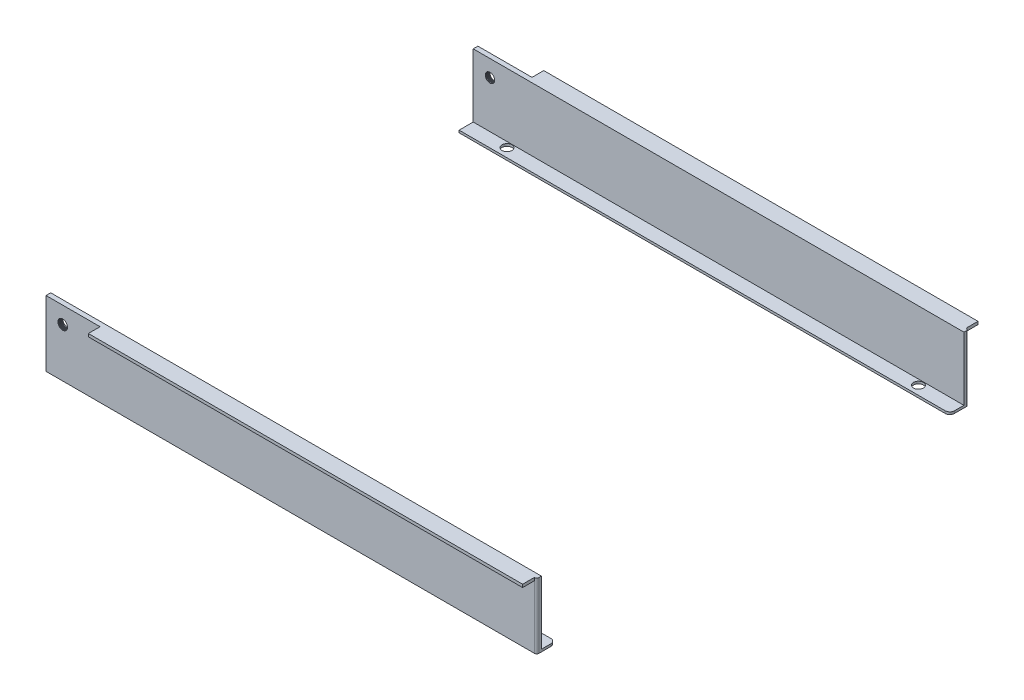
from build123d import *

# Parameters (mm, degrees)
SKETCH_1_W          = 230
SKETCH_1_H          = 30
EXTRUDE_1_DEPTH     = 2
SKETCH_2_W          = 183
SKETCH_2_H          = 1
EXTRUDE_2_DEPTH     = 5
FILLET_1_R          = 2
FILLET_2_R          = 2
SKETCH_3_W          = 230
SKETCH_3_H          = 0.999899536
EXTRUDE_3_DEPTH     = 6
FILLET_3_R          = 2
FILLET_4_R          = 2
SKETCH_4_R          = 2
CUT_EXTRUDE_1_DEPTH = 6
THREAD_1_PITCH      = 0.5
FILLET_5_R          = 2
FILLET_6_R          = 1
FILLET_7_R          = 1
SKETCH_6_W          = 24.259923812
SKETCH_6_H          = 36.468143538
CUT_EXTRUDE_5_DEPTH = 15
SKETCH_7_R          = 2.1
CUT_EXTRUDE_6_DEPTH = 10
SKETCH_8_W          = 7
SKETCH_8_H          = 2
CUT_EXTRUDE_8_DEPTH = 218
SKETCH_9_W          = 185
SKETCH_9_H          = 1.24
EXTRUDE_4_DEPTH     = 5


with BuildPart() as part:
    # Sketch 1 → 填料-伸長1 (new body)
    with BuildSketch(Plane.XY):
        Rectangle(SKETCH_1_W, SKETCH_1_H)
    extrude(amount=EXTRUDE_1_DEPTH)

    # 草圖2 → 填料-伸長2 (add)
    with BuildSketch(Plane.XY.offset(2)):
        with Locations((23.5, 14.5)):
            Rectangle(SKETCH_2_W, SKETCH_2_H)
    extrude(amount=EXTRUDE_2_DEPTH)

    # 圓角1
    fillet_1_edges = [part.edges().sort_by_distance(p)[0] for p in [
        (-68, 14.5, 7),
    ]]
    fillet(fillet_1_edges, radius=FILLET_1_R)

    # 圓角2
    fillet_2_edges = [part.edges().sort_by_distance(p)[0] for p in [
        (115, 14.5, 7),
    ]]
    fillet(fillet_2_edges, radius=FILLET_2_R)

    # 草圖3 → 填料-伸長3 (add)
    with BuildSketch(Plane(origin=(0, 0, 0), x_dir=(-1, 0, 0), z_dir=(0, 0, -1))):
        with Locations((0, -14.500050232)):
            Rectangle(SKETCH_3_W, SKETCH_3_H)
    extrude(amount=EXTRUDE_3_DEPTH)

    # 圓角3
    fillet_3_edges = [part.edges().sort_by_distance(p)[0] for p in [
        (-115, -14.500050232, -6),
    ]]
    fillet(fillet_3_edges, radius=FILLET_3_R)

    # 圓角4
    fillet_4_edges = [part.edges().sort_by_distance(p)[0] for p in [
        (115, -14.500050232, -6),
    ]]
    fillet(fillet_4_edges, radius=FILLET_4_R)

    # 草圖4 → 除料-伸長1 (cut)
    with BuildSketch(Plane.XY.offset(2)):
        with Locations((-86.90574959, 5.915633798)):
            Circle(SKETCH_4_R)
    extrude(amount=-CUT_EXTRUDE_1_DEPTH, mode=Mode.SUBTRACT)

    # 螺紋1: the profile of Sketch 1 2 profile screwed along a right-hand helix of 20 turns, 6 arcs to a turn; built about Z, then put on its axis
    thread_1_z = Axis((0, 0, 0), (0, 0, 1))
    thread_1_corners = [(1.9997, 0, -0.000173205), (2.2, 0, 0.115470054), (2.2, 0, 0.155157554), (1.9997, 0, 0.270800813)]
    with BuildLine(mode=Mode.PRIVATE) as thread_1_profile:
        Line(thread_1_corners[0], thread_1_corners[1])
        Line(thread_1_corners[1], thread_1_corners[2])
        Line(thread_1_corners[2], thread_1_corners[3])
        Line(thread_1_corners[3], thread_1_corners[0])
    thread_1_cap = Face(thread_1_profile.wire())
    thread_1_turn_angles = [0, 30, 60, 90, 120, 150, 180, 210, 240, 270, 300, 330, 360]
    thread_1_turn_weights = [1, 0.8660254037844387, 1, 0.8660254037844387, 1, 0.8660254037844387, 1, 0.8660254037844387, 1, 0.8660254037844387, 1, 0.8660254037844387, 1]
    thread_1_turn_rails = [Edge.make_bspline([Vector(p[0], p[1], 0).rotate(thread_1_z, thread_1_turn_angles[k]) / thread_1_turn_weights[k] + Vector(0, 0, p[2] + THREAD_1_PITCH * thread_1_turn_angles[k] / 360) for k in range(13)], [0, 0, 0, 1, 1, 2, 2, 3, 3, 4, 4, 5, 5, 6, 6, 6], 2, thread_1_turn_weights) for p in thread_1_corners]
    thread_1_turn_sides = [Face.make_surface_from_curves(thread_1_turn_rails[p[0]], thread_1_turn_rails[p[1]]) for p in [(0, 1), (1, 2), (2, 3), (3, 0)]]
    thread_1 = Plane(origin=(-86.90574959, 5.915633798, 0), x_dir=(1, 0, 0), z_dir=(0, 0, 1)) * Solid(Shell([*[p.moved(Location((0, 0, THREAD_1_PITCH * i))) for i in range(20) for p in thread_1_turn_sides], thread_1_cap, thread_1_cap.rotate(thread_1_z, 7200).moved(Location((0, 0, THREAD_1_PITCH * 7200 / 360)))]))
    add(thread_1, mode=Mode.SUBTRACT)

    # 圓角5
    fillet_5_edges = [part.edges().sort_by_distance(p)[0] for p in [
        (-115, 15, 1),
    ]]
    fillet(fillet_5_edges, radius=FILLET_5_R)

    # 圓角6
    fillet_6_edges = [part.edges().sort_by_distance(p)[0] for p in [
        (1, 15, 0),
        (-115, -0.500050232, 0),
        (-114.414213562, 14.414213562, 0),
    ]]
    fillet(fillet_6_edges, radius=FILLET_6_R)

    # 圓角7
    fillet_7_edges = [part.edges().sort_by_distance(p)[0] for p in [
        (115, -0.5, 2),
    ]]
    fillet(fillet_7_edges, radius=FILLET_7_R)

    # 草圖6 → 除料-伸長5 (cut)
    with BuildSketch(Plane.XY.offset(7)):
        with Locations((-106.171437047, -1.461218557)):
            Rectangle(SKETCH_6_W, SKETCH_6_H)
    extrude(amount=-CUT_EXTRUDE_5_DEPTH, mode=Mode.SUBTRACT)

    # 草圖7 → 除料-伸長6 (cut)
    with BuildSketch(Plane.XZ.offset(15)):
        with Locations(Location((-77.398663751, -2.260082643, 0), (0, 0, 270))):
            Circle(SKETCH_7_R)
        with Locations(Location((97.90088895, -2.260082643, 0), (0, 0, 270))):
            Circle(SKETCH_7_R)
    extrude(amount=-CUT_EXTRUDE_6_DEPTH, mode=Mode.SUBTRACT)

    # 草圖8 → 除料-伸長8 (cut)
    with BuildSketch(Plane(origin=(115, 0, 0), x_dir=(0, 0, -1), z_dir=(1, 0, 0))):
        with Locations((-3.5, 14)):
            Rectangle(SKETCH_8_W, SKETCH_8_H)
    extrude(amount=-CUT_EXTRUDE_8_DEPTH, mode=Mode.SUBTRACT)

    # 草圖9 → 填料-伸長4 (add)
    with BuildSketch(Plane.XY.offset(2)):
        with Locations((21.5, 12.38)):
            Rectangle(SKETCH_9_W, SKETCH_9_H)
    extrude(amount=EXTRUDE_4_DEPTH)


with BuildPart() as body_2:
    # 鏡射3: mirrored copy
    add(part.part.mirror(Plane(origin=(0, 0, -90), x_dir=(1, 0, 0), z_dir=(0, 0, -1))))


solid = Compound([part.part, body_2.part])
